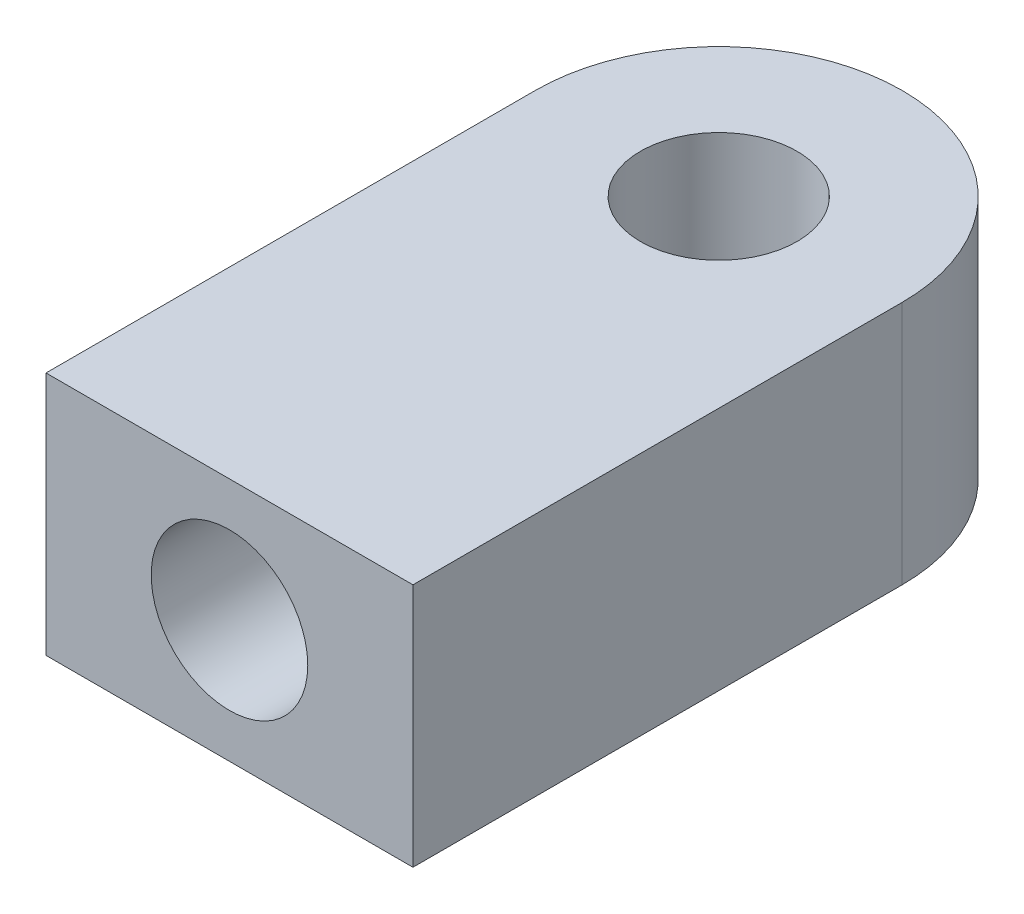
from build123d import *

# Parameters (mm, degrees)
SKETCH1_R           = 2.032
BOSS_EXTRUDE1_DEPTH = 6.35
SKETCH2_R           = 2.032
CUT_EXTRUDE1_DEPTH  = 9.525


with BuildPart() as part:
    # Sketch1 → Boss-Extrude1 (new body)
    with BuildSketch(Plane(origin=(0, 0, 0), x_dir=(1, 0, 0), z_dir=(0, 1, 0))):
        with BuildLine():
            Line((0, 0), (0, 12.7))
            ThreePointArc((0, 12.7), (4.7625, 17.4625), (9.525, 12.7))
            Line((9.525, 12.7), (9.525, 0))
            Line((9.525, 0), (0, 0))
        make_face()
        with Locations((4.7625, 12.7)):
            Circle(SKETCH1_R, mode=Mode.SUBTRACT)
    extrude(amount=BOSS_EXTRUDE1_DEPTH)

    # Sketch2 → Cut-Extrude1 (cut)
    with BuildSketch(Plane.XY):
        with Locations((4.7625, 3.175)):
            Circle(SKETCH2_R)
    extrude(amount=-CUT_EXTRUDE1_DEPTH, mode=Mode.SUBTRACT)


solid = part.part
